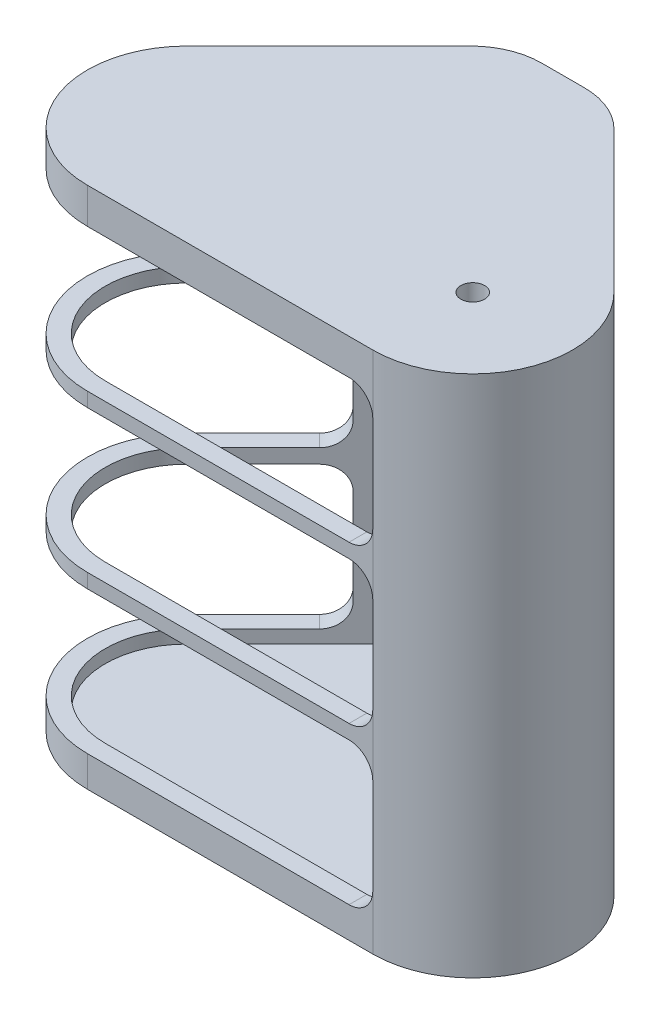
from build123d import *

# Parameters (mm, degrees)
BOSS_EXTRUDE1_DEPTH    = 558.8
SKETCH2_W              = 1233.22752028
SKETCH2_H              = 1270
SKETCH2_W_2            = 864.480609306
SKETCH2_H_2            = 355.6
CUT_EXTRUDE1_DEPTH     = 756.196292364
FILLET1_R              = 213.36
FILLET2_R              = 76.2
FILLET5_R              = 106.68
SHELL1_T               = 19.05
SKETCH7_W              = 20.32
SKETCH7_H              = 152.4
SKETCH7_2_W            = 20.32
SKETCH7_2_H            = 152.4
CUT_EXTRUDE2_DEPTH     = 152.4
FILLET6_R              = 25.4
LPATTERN1_COUNT        = 3
LPATTERN1_PITCH        = 167.64
FILLET6_OF_LPATTERN1_R = 25.4
SKETCH10_R             = 12.7
CUT_EXTRUDE3_DEPTH     = 688.251792528


with BuildPart() as part:
    # Sketch1 → Boss-Extrude1 (new body)
    with BuildSketch(Plane(origin=(0, 0, 0), x_dir=(1, 0, 0), z_dir=(0, 1, 0))):
        Polygon((359.210244843, 0), (0, -359.210244843), (-359.210244843, 0), (0, 359.210244843), align=None)
    extrude(amount=BOSS_EXTRUDE1_DEPTH)

    # Sketch2 → Cut-Extrude1 (cut, through all)
    with BuildSketch(Plane(origin=(0, 558.8, 0), x_dir=(1, 0, 0), z_dir=(0, 1, 0))):
        with Locations((0, 127)):
            Rectangle(SKETCH2_W, SKETCH2_H)
        with Locations((0, 127)):
            Rectangle(SKETCH2_W_2, SKETCH2_H_2, mode=Mode.SUBTRACT)
    extrude(amount=-CUT_EXTRUDE1_DEPTH, mode=Mode.SUBTRACT)

    # Fillet1
    # the kernel refuses this fillet: 213.36 mm, written as the material it takes off along each edge
    with BuildSketch(Plane(origin=(359.210244843, -399.180090434, 0), x_dir=(-0.707106781186546, 0, 0.707106781186549), z_dir=(0, 1, 0))) as fillet1_piece_1:
        with BuildLine():
            CenterArc((213.36, -159.672036174), FILLET1_R, 131.550696865, 48.449303135)
            Line((0, -159.672036174), (-4.2672, -159.672036174))
            Line((-4.2672, -159.672036174), (-4.2672, 0))
            Line((-4.2672, 0), (0, 4.2672))
            ThreePointArc((0, 4.2672), (35.921024484, 4.2672), (69.011689948, 3.193440723))
            Line((69.011689948, 3.193440723), (71.842048969, 0))
        make_face()
    extrude(amount=1357.160180869, mode=Mode.SUBTRACT)
    with BuildSketch(Plane(origin=(-359.210244843, -399.180090434, 0), x_dir=(0.707106781186546, 0, -0.7071067811865489), z_dir=(0, 1, 0))) as fillet1_piece_2:
        with BuildLine():
            CenterArc((159.672036174, -213.36), FILLET1_R, 90, 48.449303135)
            Line((0, -71.842048969), (-3.193440723, -69.011689948))
            ThreePointArc((-3.193440723, -69.011689948), (-4.2672, -35.921024484), (-4.2672, 0))
            Line((-4.2672, 0), (0, 4.2672))
            Line((0, 4.2672), (159.672036174, 4.2672))
            Line((159.672036174, 4.2672), (159.672036174, 0))
        make_face()
    extrude(amount=1357.160180869, mode=Mode.SUBTRACT)

    # Fillet2
    fillet2_edges = [part.edges().sort_by_distance(p)[0] for p in [
        (54.410244843, 279.4, -304.8),
        (-54.410244843, 279.4, -304.8),
    ]]
    fillet(fillet2_edges, radius=FILLET2_R)

    # Fillet5
    fillet5_edges = [part.edges().sort_by_distance(p)[0] for p in [
        (308.410244843, 279.4, 50.8),
        (-308.410244843, 279.4, 50.8),
    ]]
    fillet(fillet5_edges, radius=FILLET5_R)

    # Shell1 (no face opened: a closed hollow body)
    add(offset(amount=-SHELL1_T, mode=Mode.PRIVATE), mode=Mode.SUBTRACT)

    # Cut-Sweep1: sweep along a path in Sketch8
    with BuildLine(Plane(origin=(0, 558.8, 0), x_dir=(1, 0, 0), z_dir=(0, 1, 0))) as cut_sweep1_path:
        Line((0, -50.8), (-152.461942009, -50.8))
        ThreePointArc((-152.461942009, -50.8), (-251.021410537, 15.055331435), (-227.896093426, 131.314151417))
        Line((-227.896093426, 131.314151417), (-139.3067744, 219.903470443))
    # Sketch7 → Cut-Sweep1 (sweep, cut)
    with BuildSketch(Plane(origin=(0, 0, 0), x_dir=(0, 0, -1), z_dir=(1, 0, 0))):
        with Locations((-40.64, 444.5)):
            Rectangle(SKETCH7_W, SKETCH7_H)
    cut_sweep1 = sweep(path=cut_sweep1_path.line, mode=Mode.SUBTRACT)

    # Sketch7<2> → Cut-Extrude2 (cut)
    with BuildSketch(Plane(origin=(0, 0, 0), x_dir=(0, 0, -1), z_dir=(1, 0, 0))):
        with Locations((-40.64, 444.5)):
            Rectangle(SKETCH7_2_W, SKETCH7_2_H)
    cut_extrude2 = extrude(amount=CUT_EXTRUDE2_DEPTH, mode=Mode.SUBTRACT)

    # Fillet6
    fillet6_edges = [part.edges().sort_by_distance(p)[0] for p in [
        (-132.571582309, 520.7, -213.168278352),
        (-132.571582309, 368.3, -213.168278352),
        (152.4, 368.3, 41.275),
        (152.4, 520.7, 41.275),
    ]]
    fillet(fillet6_edges, radius=FILLET6_R)

    # LPattern1: Cut-Sweep1, Cut-Extrude2 ×3
    with Locations(*[(0, -i * LPATTERN1_PITCH, 0) for i in range(1, LPATTERN1_COUNT)]):
        add(cut_sweep1, mode=Mode.SUBTRACT)
        add(cut_extrude2, mode=Mode.SUBTRACT)

    # Fillet6 of LPattern1
    fillet6_of_lpattern1_edges = [part.edges().sort_by_distance(p)[0] for p in [
        (-132.571582309, 353.06, -213.168278352),
        (-132.571582309, 200.66, -213.168278352),
        (152.4, 200.66, 41.275),
        (152.4, 353.06, 41.275),
        (-132.571582309, 185.42, -213.168278352),
        (-132.571582309, 33.02, -213.168278352),
        (152.4, 33.02, 41.275),
        (152.4, 185.42, 41.275),
    ]]
    fillet(fillet6_of_lpattern1_edges, radius=FILLET6_OF_LPATTERN1_R)

    # Sketch10 → Cut-Extrude3 (cut, through all)
    with BuildSketch(Plane(origin=(0, 558.8, 0), x_dir=(1, 0, 0), z_dir=(0, 1, 0))):
        with Locations(Location((152.461942009, 55.88, 0), (0, 0, 270))):
            Circle(SKETCH10_R)
    extrude(amount=-CUT_EXTRUDE3_DEPTH, mode=Mode.SUBTRACT)


solid = part.part
